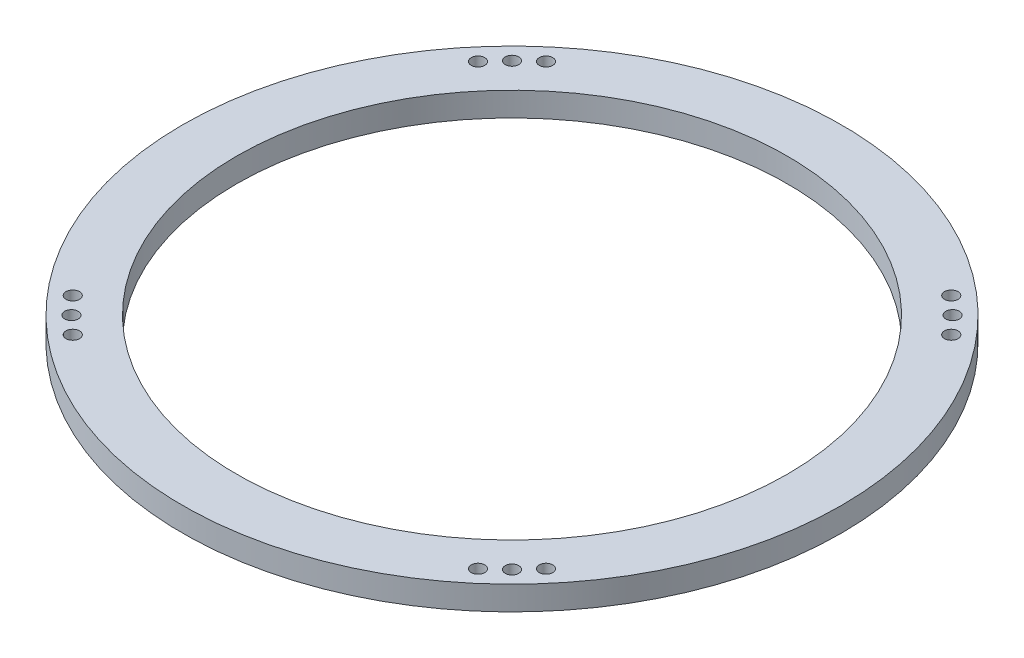
from build123d import *

# Parameters (mm, degrees)
SKETCH1_W                       = 28.575
SKETCH1_H                       = 12.7
F_9_32_0_28125_DIAMETER_HOLE1_D = 7.14375
CIRPATTERN1_COUNT               = 4


with BuildPart() as part:
    # Sketch1 → Revolve1 (revolve)
    with BuildSketch(Plane.XY):
        with Locations((159.813733777, 200.022409282)):
            Rectangle(SKETCH1_W, SKETCH1_H)
    revolve(axis=Axis((1e-09, -200000, 0), (0, 1, 0)))

    # 9/32 (0.28125) Diameter Hole1 (through all)
    with Locations(Plane(origin=(0, 206.372409282, 0), x_dir=(1, 0, 0), z_dir=(0, 1, 0))):
        with Locations((-116.372970926, 116.372970926), (-107.045703742, 125.006215984), (-125.006215984, 107.045703742)):
            f_9_32_0_28125_diameter_hole1 = Hole(F_9_32_0_28125_DIAMETER_HOLE1_D / 2)

    # CirPattern1: 9/32 (0.28125) Diameter Hole1 ×4 about axis
    cirpattern1_axis = Axis((1e-09, -200000, 0), (0, -1, 0))
    for i in range(1, CIRPATTERN1_COUNT):
        add(f_9_32_0_28125_diameter_hole1.rotate(cirpattern1_axis, i * 360 / CIRPATTERN1_COUNT), mode=Mode.SUBTRACT)


solid = part.part
